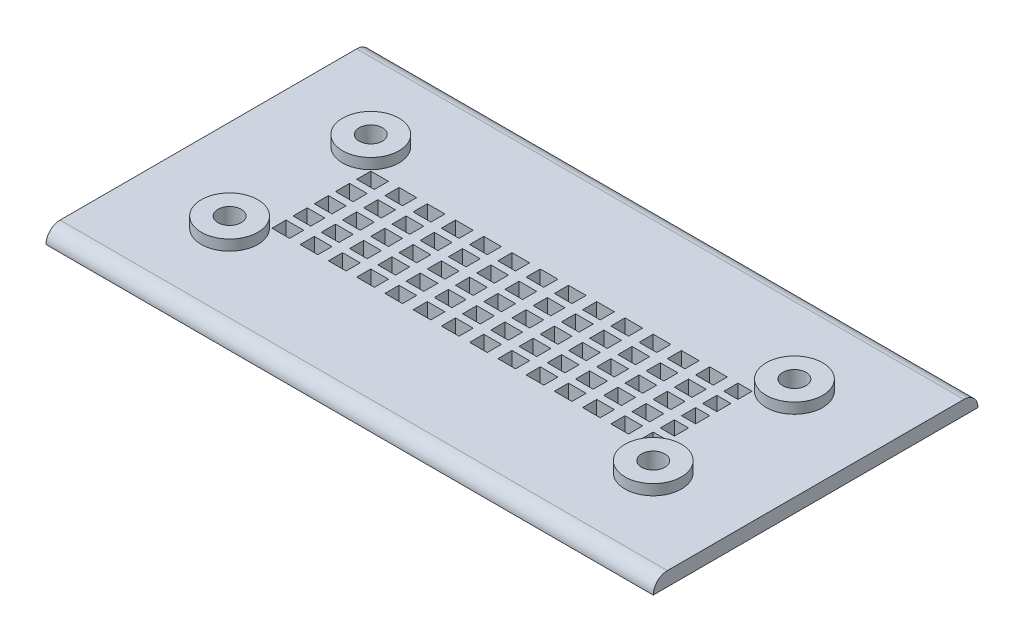
from build123d import *

# Parameters (mm, degrees)
SKETCH1_W               = 86
SKETCH1_H               = 46
BOSS_EXTRUDE1_DEPTH     = 2
SKETCH2_W               = 54
SKETCH2_H               = 14
CUT_EXTRUDE1_DEPTH      = 49.805737368
SKETCH4_R               = 4
BOSS_EXTRUDE2_DEPTH     = 1.5
CUT_EXTRUDE2_DEPTH      = 1.5
CUT_EXTRUDE2_DEPTH_BACK = 10
SKETCH3_R               = 1.65
SKETCH5_W               = 74
SKETCH5_H               = 34
SKETCH5_W_2             = 70
SKETCH5_H_2             = 30
CUT_EXTRUDE3_DEPTH      = 10
CUT_EXTRUDE3_TAPER      = 45
FILLET1_R               = 2
FILLET2_R               = 2
SKETCH6_W               = 2.5
SKETCH6_H               = 2
GRID_DEPTH              = 2


with BuildPart() as part:
    # Sketch1 → Boss-Extrude1 (new body)
    with BuildSketch(Plane(origin=(0, 0, 0), x_dir=(1, 0, 0), z_dir=(0, 1, 0))):
        Rectangle(SKETCH1_W, SKETCH1_H)
    extrude(amount=BOSS_EXTRUDE1_DEPTH)

    # Sketch2 → Cut-Extrude1 (cut, through all)
    with BuildSketch(Plane(origin=(0, 2, 0), x_dir=(1, 0, 0), z_dir=(0, 1, 0))):
        Rectangle(SKETCH2_W, SKETCH2_H)
    extrude(amount=-CUT_EXTRUDE1_DEPTH, mode=Mode.SUBTRACT)

    # Sketch4 → Boss-Extrude2 (add)
    with BuildSketch(Plane(origin=(0, 2, 0), x_dir=(1, 0, 0), z_dir=(0, 1, 0))):
        with Locations(Location((-30, 10, 0), (0, 0, 270))):
            Circle(SKETCH4_R)
        with Locations(Location((-30, -10, 0), (0, 0, 90))):
            Circle(SKETCH4_R)
        with Locations(Location((30, -10, 0), (0, 0, 270))):
            Circle(SKETCH4_R)
        with Locations(Location((30, 10, 0), (0, 0, 90))):
            Circle(SKETCH4_R)
    extrude(amount=BOSS_EXTRUDE2_DEPTH)

    # Sketch3 → Cut-Extrude2 (cut, two sides: drawn at the far end of the back side and taken through both)
    with BuildSketch(Plane(origin=(0, 2, 0), x_dir=(1, 0, 0), z_dir=(0, 1, 0)).offset(-CUT_EXTRUDE2_DEPTH_BACK)):
        with Locations(Location((-30, 10, 0), (0, 0, 270))):
            Circle(SKETCH3_R)
        with Locations(Location((30, 10, 0), (0, 0, 270))):
            Circle(SKETCH3_R)
        with Locations(Location((30, -10, 0), (0, 0, 270))):
            Circle(SKETCH3_R)
        with Locations(Location((-30, -10, 0), (0, 0, 270))):
            Circle(SKETCH3_R)
    extrude(amount=CUT_EXTRUDE2_DEPTH + CUT_EXTRUDE2_DEPTH_BACK, mode=Mode.SUBTRACT)

    # Sketch5 → Cut-Extrude3 (cut)
    with BuildSketch(Plane.XZ):
        Rectangle(SKETCH5_W, SKETCH5_H)
        Rectangle(SKETCH5_W_2, SKETCH5_H_2, mode=Mode.SUBTRACT)
    extrude(amount=-CUT_EXTRUDE3_DEPTH, taper=CUT_EXTRUDE3_TAPER, mode=Mode.SUBTRACT)

    # Fillet1
    fillet1_edges = [part.edges().sort_by_distance(p)[0] for p in [
        (0, 2, -23),
    ]]
    fillet(fillet1_edges, radius=FILLET1_R - 0.0001)  # a hair under: the kernel refuses the full size

    # Fillet2
    fillet2_edges = [part.edges().sort_by_distance(p)[0] for p in [
        (0, 2, 23),
    ]]
    fillet(fillet2_edges, radius=FILLET2_R - 0.0001)  # a hair under: the kernel refuses the full size

    # Sketch6 → Grid (add)
    with BuildSketch(Plane.XZ):
        Polygon((-24.5, 7), (-23, 7), (-23, 5), (-20.5, 5), (-20.5, 7), (-19, 7), (-19, 5), (-16.5, 5), (-16.5, 7), (-15, 7), (-15, 5), (-12.5, 5), (-12.5, 7), (-11, 7), (-11, 5), (-8.5, 5), (-8.5, 7), (-7, 7), (-7, 5), (-4.5, 5), (-4.5, 7), (-3, 7), (-3, 5), (-0.5, 5), (-0.5, 7), (1, 7), (1, 5), (3.5, 5), (3.5, 7), (5, 7), (5, 5), (7.5, 5), (7.5, 7), (9, 7), (9, 5), (11.5, 5), (11.5, 7), (13, 7), (13, 5), (15.5, 5), (15.5, 7), (17, 7), (17, 5), (19.5, 5), (19.5, 7), (21, 7), (21, 5), (23.5, 5), (23.5, 7), (25, 7), (25, 5), (27, 5), (27, 4), (25, 4), (25, 2), (27, 2), (27, 1), (25, 1), (25, -1), (27, -1), (27, -2), (25, -2), (25, -4), (27, -4), (27, -5), (25, -5), (25, -7), (23.5, -7), (23.5, -5), (21, -5), (21, -7), (19.5, -7), (19.5, -5), (17, -5), (17, -7), (15.5, -7), (15.5, -5), (13, -5), (13, -7), (11.5, -7), (11.5, -5), (9, -5), (9, -7), (7.5, -7), (7.5, -5), (5, -5), (5, -7), (3.5, -7), (3.5, -5), (1, -5), (1, -7), (-0.5, -7), (-0.5, -5), (-3, -5), (-3, -7), (-4.5, -7), (-4.5, -5), (-7, -5), (-7, -7), (-8.5, -7), (-8.5, -5), (-11, -5), (-11, -7), (-12.5, -7), (-12.5, -5), (-15, -5), (-15, -7), (-16.5, -7), (-16.5, -5), (-19, -5), (-19, -7), (-20.5, -7), (-20.5, -5), (-23, -5), (-23, -7), (-24.5, -7), (-24.5, -5), (-27, -5), (-27, -4), (-24.5, -4), (-24.5, -2), (-27, -2), (-27, -1), (-24.5, -1), (-24.5, 1), (-27, 1), (-27, 2), (-24.5, 2), (-24.5, 4), (-27, 4), (-27, 5), (-24.5, 5), align=None)
        with Locations((-21.75, 0)):
            Rectangle(SKETCH6_W, SKETCH6_H, mode=Mode.SUBTRACT)
        with Locations((-21.75, 3)):
            Rectangle(SKETCH6_W, SKETCH6_H, mode=Mode.SUBTRACT)
        with Locations((-21.75, -3)):
            Rectangle(SKETCH6_W, SKETCH6_H, mode=Mode.SUBTRACT)
        with Locations((-13.75, 3)):
            Rectangle(SKETCH6_W, SKETCH6_H, mode=Mode.SUBTRACT)
        with Locations((-17.75, 3)):
            Rectangle(SKETCH6_W, SKETCH6_H, mode=Mode.SUBTRACT)
        with Locations((-17.75, 0)):
            Rectangle(SKETCH6_W, SKETCH6_H, mode=Mode.SUBTRACT)
        with Locations((-17.75, -3)):
            Rectangle(SKETCH6_W, SKETCH6_H, mode=Mode.SUBTRACT)
        with Locations((-13.75, 0)):
            Rectangle(SKETCH6_W, SKETCH6_H, mode=Mode.SUBTRACT)
        with Locations((-13.75, -3)):
            Rectangle(SKETCH6_W, SKETCH6_H, mode=Mode.SUBTRACT)
        with Locations((6.25, 3)):
            Rectangle(SKETCH6_W, SKETCH6_H, mode=Mode.SUBTRACT)
        with Locations((-9.75, 3)):
            Rectangle(SKETCH6_W, SKETCH6_H, mode=Mode.SUBTRACT)
        with Locations((-9.75, 0)):
            Rectangle(SKETCH6_W, SKETCH6_H, mode=Mode.SUBTRACT)
        with Locations((-9.75, -3)):
            Rectangle(SKETCH6_W, SKETCH6_H, mode=Mode.SUBTRACT)
        with Locations((-1.75, 3)):
            Rectangle(SKETCH6_W, SKETCH6_H, mode=Mode.SUBTRACT)
        with Locations((-5.75, -3)):
            Rectangle(SKETCH6_W, SKETCH6_H, mode=Mode.SUBTRACT)
        with Locations((10.25, 3)):
            Rectangle(SKETCH6_W, SKETCH6_H, mode=Mode.SUBTRACT)
        with Locations((-5.75, 3)):
            Rectangle(SKETCH6_W, SKETCH6_H, mode=Mode.SUBTRACT)
        with Locations((-5.75, 0)):
            Rectangle(SKETCH6_W, SKETCH6_H, mode=Mode.SUBTRACT)
        with Locations((14.25, 3)):
            Rectangle(SKETCH6_W, SKETCH6_H, mode=Mode.SUBTRACT)
        with Locations((-1.75, 0)):
            Rectangle(SKETCH6_W, SKETCH6_H, mode=Mode.SUBTRACT)
        with Locations((-1.75, -3)):
            Rectangle(SKETCH6_W, SKETCH6_H, mode=Mode.SUBTRACT)
        with Locations((18.25, 3)):
            Rectangle(SKETCH6_W, SKETCH6_H, mode=Mode.SUBTRACT)
        with Locations((2.25, 3)):
            Rectangle(SKETCH6_W, SKETCH6_H, mode=Mode.SUBTRACT)
        with Locations((2.25, 0)):
            Rectangle(SKETCH6_W, SKETCH6_H, mode=Mode.SUBTRACT)
        with Locations((2.25, -3)):
            Rectangle(SKETCH6_W, SKETCH6_H, mode=Mode.SUBTRACT)
        with Locations((14.25, 0)):
            Rectangle(SKETCH6_W, SKETCH6_H, mode=Mode.SUBTRACT)
        with Locations((10.25, 0)):
            Rectangle(SKETCH6_W, SKETCH6_H, mode=Mode.SUBTRACT)
        with Locations((6.25, 0)):
            Rectangle(SKETCH6_W, SKETCH6_H, mode=Mode.SUBTRACT)
        with Locations((6.25, -3)):
            Rectangle(SKETCH6_W, SKETCH6_H, mode=Mode.SUBTRACT)
        with Locations((18.25, 0)):
            Rectangle(SKETCH6_W, SKETCH6_H, mode=Mode.SUBTRACT)
        with Locations((10.25, -3)):
            Rectangle(SKETCH6_W, SKETCH6_H, mode=Mode.SUBTRACT)
        with Locations((22.25, 0)):
            Rectangle(SKETCH6_W, SKETCH6_H, mode=Mode.SUBTRACT)
        with Locations((14.25, -3)):
            Rectangle(SKETCH6_W, SKETCH6_H, mode=Mode.SUBTRACT)
        with Locations((22.25, -3)):
            Rectangle(SKETCH6_W, SKETCH6_H, mode=Mode.SUBTRACT)
        with Locations((18.25, -3)):
            Rectangle(SKETCH6_W, SKETCH6_H, mode=Mode.SUBTRACT)
        with Locations((22.25, 3)):
            Rectangle(SKETCH6_W, SKETCH6_H, mode=Mode.SUBTRACT)
    extrude(amount=-GRID_DEPTH)


solid = part.part
